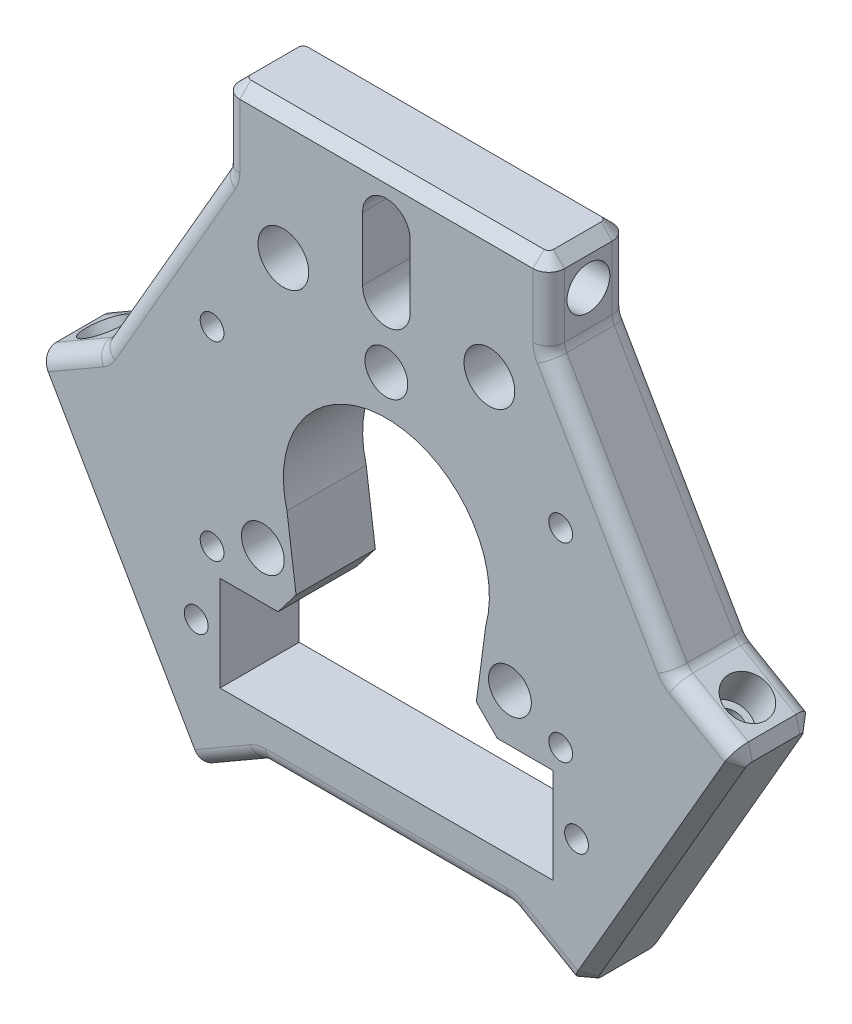
from build123d import *
from OCP.BRepFilletAPI import BRepFilletAPI_MakeChamfer

# Parameters (mm, degrees)
SKETCH_1_R                         = 13
EXTRUDE_1_DEPTH                    = 10
SKETCH_2_R                         = 2.7
CUT_EXTRUDE_1_DEPTH                = 5
PATTERN_CIRCULAR_1_COUNT           = 3
PATTERN_CIRCULAR_1_COPY_1_SKETCH_R = 2.7
PATTERN_CIRCULAR_1_COPY_1_DEPTH    = 5
PATTERN_CIRCULAR_1_COPY_2_SKETCH_R = 2.7
PATTERN_CIRCULAR_1_COPY_2_DEPTH    = 5
SKETCH_3_R                         = 2.7
SKETCH_3_R_2                       = 2.699999999999997
SKETCH_3_R_3                       = 2.700000000000001
CUT_EXTRUDE_2_DEPTH                = 5
SKETCH_4_R                         = 1.5000000000000009
SKETCH_4_R_2                       = 1.5000000000000042
CUT_EXTRUDE_3_DEPTH                = 61.95246780158357
CUT_EXTRUDE_5_DEPTH                = 61.95246780158357
SKETCH_7_R                         = 3.2
SKETCH_7_R_2                       = 3.1999999999999984
CUT_EXTRUDE_6_DEPTH                = 8
CHAMFER_2_SIZE                     = 1.4
FILLET_2_R                         = 2
CHAMFER_3_SIZE                     = 1.4
SKETCH_9_R                         = 1.8000000000000005
SKETCH_9_R_2                       = 1.7999999999999987
SKETCH_9_R_3                       = 1.8
CUT_EXTRUDE_8_DEPTH                = 60.81513460321006
SKETCH_10_R                        = 1.8000000000000014
CUT_EXTRUDE_9_DEPTH                = 10
PATTERN_CIRCULAR_2_COUNT           = 3
PATTERN_CIRCULAR_2_COPY_1_SKETCH_R = 1.8000000000000014
PATTERN_CIRCULAR_2_COPY_1_DEPTH    = 10
PATTERN_CIRCULAR_2_COPY_2_SKETCH_R = 1.8000000000000014
PATTERN_CIRCULAR_2_COPY_2_DEPTH    = 10
SKETCH_11_R                        = 1.5000000000000009
CUT_EXTRUDE_10_DEPTH               = 61.43881474350847
SKETCH_12_R                        = 2.6999999999999993
CUT_EXTRUDE_11_DEPTH               = 61.140255466701646
CUT_EXTRUDE_12_DEPTH               = 61.43881474350847
CHAMFER_4_SIZE                     = 3
CHAMFER_4_SIZE2                    = 2.6704845794861627
CHAMFER_4_SIZE2_2                  = 2.670484579486165


with BuildPart() as part:
    # 草圖1 → 填料-伸長1 (new body)
    with BuildSketch(Plane.XY):
        Polygon((-20.49999999999998, 39.999999999999986), (20.49999999999997, 39.99999999999999), (20.499999999999982, 29.999999999999993), (36.23076211353136, 2.753520777584056), (44.891016151375794, -2.2464792224159686), (24.39101615137583, -37.753520777577926), (15.730762113531437, -32.75352077757793), (-15.730762113531332, -32.753520777577926), (-24.391016151375762, -37.75352077757796), (-44.891016151375766, -2.2464792224160335), (-36.23076211353138, 2.7535207775839847), (-20.49999999999998, 29.999999999999936), align=None)
        Circle(SKETCH_1_R, mode=Mode.SUBTRACT)
    extrude(amount=EXTRUDE_1_DEPTH)

    # 草圖2 → 除料-伸長1 (cut)
    with BuildSketch(Plane.ZY.offset(20.49999999999998)):
        with Locations((5, 34.999999999999964)):
            Circle(SKETCH_2_R)
    cut_extrude_1 = extrude(amount=-CUT_EXTRUDE_1_DEPTH, mode=Mode.SUBTRACT)

    # 鏡射1: 除料-伸長1 across plane
    add(cut_extrude_1.mirror(Plane(origin=(0, 0, 0), x_dir=(0, 0, 1), z_dir=(1, 0, 0))), mode=Mode.SUBTRACT)

    # 環狀複製排列1: 除料-伸長1 ×3 about axis
    pattern_circular_1_axis = Axis((1.45e-15, -5e-16, 0), (0, 0, 1))
    for i in range(1, PATTERN_CIRCULAR_1_COUNT):
        add(cut_extrude_1.rotate(pattern_circular_1_axis, i * 360 / PATTERN_CIRCULAR_1_COUNT), mode=Mode.SUBTRACT)

    # 環狀複製排列1 copy 1 sketch → 環狀複製排列1 copy 1 (cut)
    with BuildSketch(Plane(origin=(-10.249999999999982, 17.75352077758097, 0), x_dir=(0, 0, 1), z_dir=(-0.4999999999999998, 0.8660254037844387, 0))):
        with Locations((5, -34.999999999999964)):
            Circle(PATTERN_CIRCULAR_1_COPY_1_SKETCH_R)
    extrude(amount=-PATTERN_CIRCULAR_1_COPY_1_DEPTH, mode=Mode.SUBTRACT)

    # 環狀複製排列1 copy 2 sketch → 環狀複製排列1 copy 2 (cut)
    with BuildSketch(Plane(origin=(-10.249999999999996, -17.753520777580967, 0), x_dir=(0, 0, 1), z_dir=(-0.5000000000000004, -0.8660254037844384, 0))):
        with Locations((5, -34.999999999999964)):
            Circle(PATTERN_CIRCULAR_1_COPY_2_SKETCH_R)
    extrude(amount=-PATTERN_CIRCULAR_1_COPY_2_DEPTH, mode=Mode.SUBTRACT)

    # 草圖3 → 除料-伸長2 (cut)
    with BuildSketch(Plane(origin=(0, 0, 10), x_dir=(-1, 0, 0), z_dir=(0, 0, -1))):
        with Locations((2.04439e-12, 18)):
            Circle(SKETCH_3_R)
        with Locations((15.588457268121106, -9.000000000000483)):
            Circle(SKETCH_3_R_2)
        with Locations((-15.588457268118686, -8.999999999999522)):
            Circle(SKETCH_3_R_3)
    extrude(amount=CUT_EXTRUDE_2_DEPTH, mode=Mode.SUBTRACT)

    # 草圖4 → 除料-伸長3 (cut, through all)
    with BuildSketch(Plane(origin=(0, 0, 0), x_dir=(-1, 0, 0), z_dir=(0, 0, -1))):
        with Locations((22, -12)):
            Circle(SKETCH_4_R)
        with Locations((21.999999999999986, 12.000000000000002)):
            Circle(SKETCH_4_R)
        with Locations(Location((-21.999999999999986, 12.000000000000002, 0), (0, 0, 180))):
            Circle(SKETCH_4_R_2)
        with Locations(Location((-22, -12, 0), (0, 0, 180))):
            Circle(SKETCH_4_R)
    extrude(amount=-CUT_EXTRUDE_3_DEPTH, mode=Mode.SUBTRACT)

    # 草圖6 → 除料-伸長5 (cut, through all)
    with BuildSketch(Plane.XY.offset(10)):
        with BuildLine():
            Line((3, 34), (3.0000000000000013, 26))
            ThreePointArc((3.0000000000000013, 26), (1.8e-16, 23), (-2.9999999999999996, 26))
            Line((-2.9999999999999996, 26), (-3.000000000000001, 34))
            ThreePointArc((-3.000000000000001, 34), (-6e-17, 37), (3, 34))
        make_face()
    extrude(amount=-CUT_EXTRUDE_5_DEPTH, mode=Mode.SUBTRACT)

    # 草圖7 → 除料-伸長6 (cut)
    with BuildSketch(Plane.XY.offset(10)):
        with Locations((-13.000000000000004, 24)):
            Circle(SKETCH_7_R)
        with Locations(Location((12.999999999999996, 24.000000000000004, 0), (0, 0, 180))):
            Circle(SKETCH_7_R_2)
    extrude(amount=-CUT_EXTRUDE_6_DEPTH, mode=Mode.SUBTRACT)

    # 導角2
    chamfer_2_edges = [part.edges().sort_by_distance(p)[0] for p in [
        (-34.641016151375766, -19.999999999996998, 10),
        (-3.55e-15, 39.999999999999986, 0),
        (34.64101615137581, -19.999999999996945, 0),
        (-34.641016151375766, -19.999999999996998, 0),
        (34.64101615137581, -19.999999999996945, 10),
        (-3.55e-15, 39.999999999999986, 10),
    ]]
    chamfer(chamfer_2_edges, length=CHAMFER_2_SIZE)

    # 圓角2
    fillet_2_edges = [part.edges().sort_by_distance(p)[0] for p in [
        (39.95467134980447, 0.6035207775840439, 10),
        (39.95467134980447, 0.6035207775840439, 0),
        (20.49999999999998, 34.3, 10),
        (20.49999999999998, 34.29999999999999, 0),
        (-20.49999999999998, 34.29999999999996, 10),
        (-20.49999999999998, 34.29999999999996, 0),
        (-39.95467134980447, 0.6035207775839742, 10),
        (-39.95467134980447, 0.603520777583975, 0),
        (-19.454671349804443, -34.903520777577945, 10),
        (-19.454671349804443, -34.903520777577945, 0),
        (19.45467134980452, -34.903520777577924, 10),
        (19.45467134980452, -34.903520777577924, 0),
        (36.23076211353136, 2.753520777584056, 5),
        (28.36538105676567, 16.376760388792025, 10),
        (20.499999999999982, 29.999999999999993, 5),
        (28.36538105676567, 16.376760388792025, 0),
        (-20.49999999999998, 29.999999999999936, 5),
        (-28.365381056765678, 16.376760388791958, 10),
        (-36.23076211353138, 2.7535207775839847, 5),
        (-28.365381056765678, 16.376760388791958, 0),
        (-15.730762113531332, -32.753520777577926, 5),
        (5.329e-14, -32.75352077757793, 10),
        (15.730762113531437, -32.75352077757793, 5),
        (5.329e-14, -32.75352077757793, 0),
    ]]
    fillet(fillet_2_edges, radius=FILLET_2_R)

    # 導角3
    chamfer_3_edges = [part.edges().sort_by_distance(p)[0] for p in [
        (20.476835451633185, 39.99999999999999, 8.30351539856506),
        (20.476835451633185, 39.99999999999999, 1.6964846014349406),
        (20.49999999999997, 39.99999999999999, 5),
        (44.8794338771924, -2.266540309768801, 8.303515398565063),
        (44.8794338771924, -2.266540309768801, 1.6964846014349366),
        (44.891016151375794, -2.2464792224159686, 5),
        (24.402598425559223, -37.73345969022509, 8.303515398565105),
        (24.402598425559223, -37.73345969022509, 1.6964846014348944),
        (24.39101615137583, -37.753520777577926, 5),
        (-24.402598425559155, -37.73345969022514, 8.30351539856507),
        (-24.402598425559155, -37.73345969022514, 1.6964846014349295),
        (-24.391016151375762, -37.75352077757796, 5),
        (-44.879433877192376, -2.2665403097688666, 8.303515398565079),
        (-44.879433877192376, -2.2665403097688643, 1.6964846014349226),
        (-44.891016151375766, -2.2464792224160335, 5),
        (-20.476835451633193, 39.999999999999986, 8.303515398565068),
        (-20.476835451633193, 39.999999999999986, 1.696484601434932),
        (-20.49999999999998, 39.999999999999986, 5),
    ]]
    chamfer(chamfer_3_edges, length=CHAMFER_3_SIZE - 0.0001)  # a hair under: the kernel refuses the full size

    # 草圖9 → 除料-伸長8 (cut, through all)
    with BuildSketch(Plane.XY.offset(5)):
        with Locations((15.588457268118686, -8.999999999999522)):
            Circle(SKETCH_9_R)
        with Locations((-15.58845726811887, -8.999999999999208)):
            Circle(SKETCH_9_R_2)
        with Locations((1.8019e-13, 17.999999999998714)):
            Circle(SKETCH_9_R_3)
    extrude(amount=-CUT_EXTRUDE_8_DEPTH, mode=Mode.SUBTRACT)

    # 草圖10 → 除料-伸長9 (cut)
    with BuildSketch(Plane.ZY.offset(15.499999999999979)):
        with Locations((5, 34.999999999999964)):
            Circle(SKETCH_10_R)
    cut_extrude_9 = extrude(amount=-CUT_EXTRUDE_9_DEPTH, mode=Mode.SUBTRACT)

    # 鏡射2: 除料-伸長9 across plane
    add(cut_extrude_9.mirror(Plane(origin=(0, 0, 0), x_dir=(0, 0, 1), z_dir=(1, 0, 0))), mode=Mode.SUBTRACT)

    # 環狀複製排列2: 除料-伸長9 ×3 about axis
    pattern_circular_2_axis = Axis((5.8e-16, 1e-15, 0), (0, 0, 1))
    for i in range(1, PATTERN_CIRCULAR_2_COUNT):
        add(cut_extrude_9.rotate(pattern_circular_2_axis, i * 360 / PATTERN_CIRCULAR_2_COUNT), mode=Mode.SUBTRACT)

    # 環狀複製排列2 copy 1 sketch → 環狀複製排列2 copy 1 (cut)
    with BuildSketch(Plane(origin=(-7.749999999999984, 13.423393758658783, 0), x_dir=(0, 0, 1), z_dir=(-0.4999999999999998, 0.8660254037844387, 0))):
        with Locations((5, -34.999999999999964)):
            Circle(PATTERN_CIRCULAR_2_COPY_1_SKETCH_R)
    extrude(amount=-PATTERN_CIRCULAR_2_COPY_1_DEPTH, mode=Mode.SUBTRACT)

    # 環狀複製排列2 copy 2 sketch → 環狀複製排列2 copy 2 (cut)
    with BuildSketch(Plane(origin=(-7.7499999999999964, -13.423393758658774, 0), x_dir=(0, 0, 1), z_dir=(-0.5000000000000004, -0.8660254037844384, 0))):
        with Locations((5, -34.999999999999964)):
            Circle(PATTERN_CIRCULAR_2_COPY_2_SKETCH_R)
    extrude(amount=-PATTERN_CIRCULAR_2_COPY_2_DEPTH, mode=Mode.SUBTRACT)

    # 草圖11 → 除料-伸長10 (cut, through all)
    with BuildSketch(Plane(origin=(0, 0, 0), x_dir=(-1, 0, 0), z_dir=(0, 0, -1))):
        with Locations((24, -20.999999999999996)):
            Circle(SKETCH_11_R)
        with Locations((-24, -20.999999999999996)):
            Circle(SKETCH_11_R)
        Polygon((-21, -15), (21, -15), (20.999999999999996, -27), (-20.999999999999996, -27), align=None)
    extrude(amount=-CUT_EXTRUDE_10_DEPTH, mode=Mode.SUBTRACT)

    # 草圖12 → 除料-伸長11 (cut, through all)
    with BuildSketch(Plane.XY.offset(2)):
        with Locations((-13.000000000000004, 24)):
            Circle(SKETCH_12_R)
        with Locations((12.999999999999996, 24.000000000000004)):
            Circle(SKETCH_12_R)
    extrude(amount=-CUT_EXTRUDE_11_DEPTH, mode=Mode.SUBTRACT)

    # 草圖13 → 除料-伸長12 (cut, through all)
    with BuildSketch(Plane.XY.offset(10)):
        Polygon((-13.000000000000002, 0), (-11, -14.999999999999996), (10.999999999999986, -15.000000000000007), (13.000000000000002, -1.203e-14), align=None)
    extrude(amount=-CUT_EXTRUDE_12_DEPTH, mode=Mode.SUBTRACT)

    # 導角4: one chamfer whose edges measure the first distance from different faces: ONE call of the kernel's chamfer builder (chamfer() names one face for all edges)
    chamfer_4_edges_1 = [part.edges().sort_by_distance(p)[0] for p in [
        (10.999999999999986, -15.000000000000007, 5),
    ]]
    chamfer_4_side_1 = [part.faces().sort_by_distance(p)[0] for p in [
        (15.999999999999993, -15, 5),
    ]]
    chamfer_4_edges_2 = [part.edges().sort_by_distance(p)[0] for p in [
        (-11, -14.999999999999996, 5),
    ]]
    chamfer_4_side_2 = [part.faces().sort_by_distance(p)[0] for p in [
        (-11.772925764192141, -9.203056768558943, 5),
    ]]
    chamfer_4 = BRepFilletAPI_MakeChamfer(part.part.solid().wrapped)
    for e in chamfer_4_edges_1:
        chamfer_4.Add(CHAMFER_4_SIZE, CHAMFER_4_SIZE2, e.wrapped, chamfer_4_side_1[0].wrapped)  # the first distance lies on this face
    for e in chamfer_4_edges_2:
        chamfer_4.Add(CHAMFER_4_SIZE, CHAMFER_4_SIZE2_2, e.wrapped, chamfer_4_side_2[0].wrapped)  # the first distance lies on this face
    add(Compound.cast(chamfer_4.Shape()), mode=Mode.REPLACE)


solid = part.part
